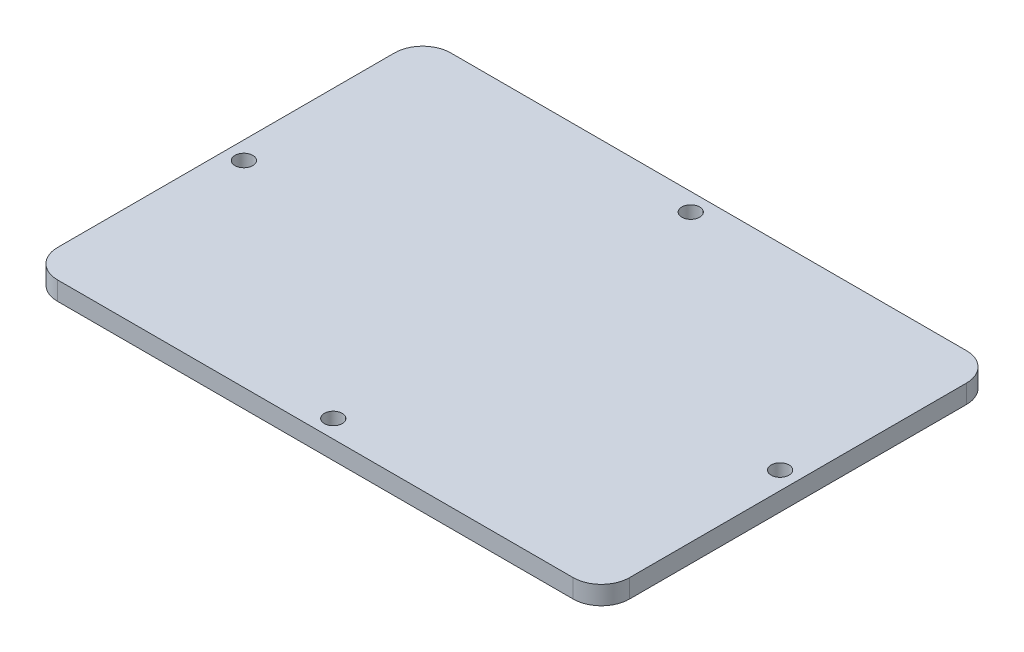
from build123d import *

# Parameters (mm, degrees)
SKETCH1_W           = 101.6
SKETCH1_H           = 69.85
BOSS_EXTRUDE1_DEPTH = 3.302
SKETCH4_R           = 1.5875
CUT_EXTRUDE1_DEPTH  = 62.735717611
FILLET1_R           = 5


with BuildPart() as part:
    # Sketch1 → Boss-Extrude1 (new body)
    with BuildSketch(Plane(origin=(0, 0, 0), x_dir=(1, 0, 0), z_dir=(0, 1, 0))):
        Rectangle(SKETCH1_W, SKETCH1_H)
    extrude(amount=BOSS_EXTRUDE1_DEPTH)

    # Sketch4 → Cut-Extrude1 (cut, through all)
    with BuildSketch(Plane(origin=(0, 0, 0), x_dir=(-1, 0, 0), z_dir=(0, -1, 0))):
        with Locations((0, 31.75)):
            Circle(SKETCH4_R)
        with Locations((-47.625, 0)):
            Circle(SKETCH4_R)
        with Locations((0, -31.75)):
            Circle(SKETCH4_R)
        with Locations((47.625, 0)):
            Circle(SKETCH4_R)
    extrude(amount=-CUT_EXTRUDE1_DEPTH, mode=Mode.SUBTRACT)

    # Fillet1
    fillet1_edges = [part.edges().sort_by_distance(p)[0] for p in [
        (50.8, 1.651, -34.925),
        (50.8, 1.651, 34.925),
        (-50.8, 1.651, 34.925),
        (-50.8, 1.651, -34.925),
    ]]
    fillet(fillet1_edges, radius=FILLET1_R)


solid = part.part
